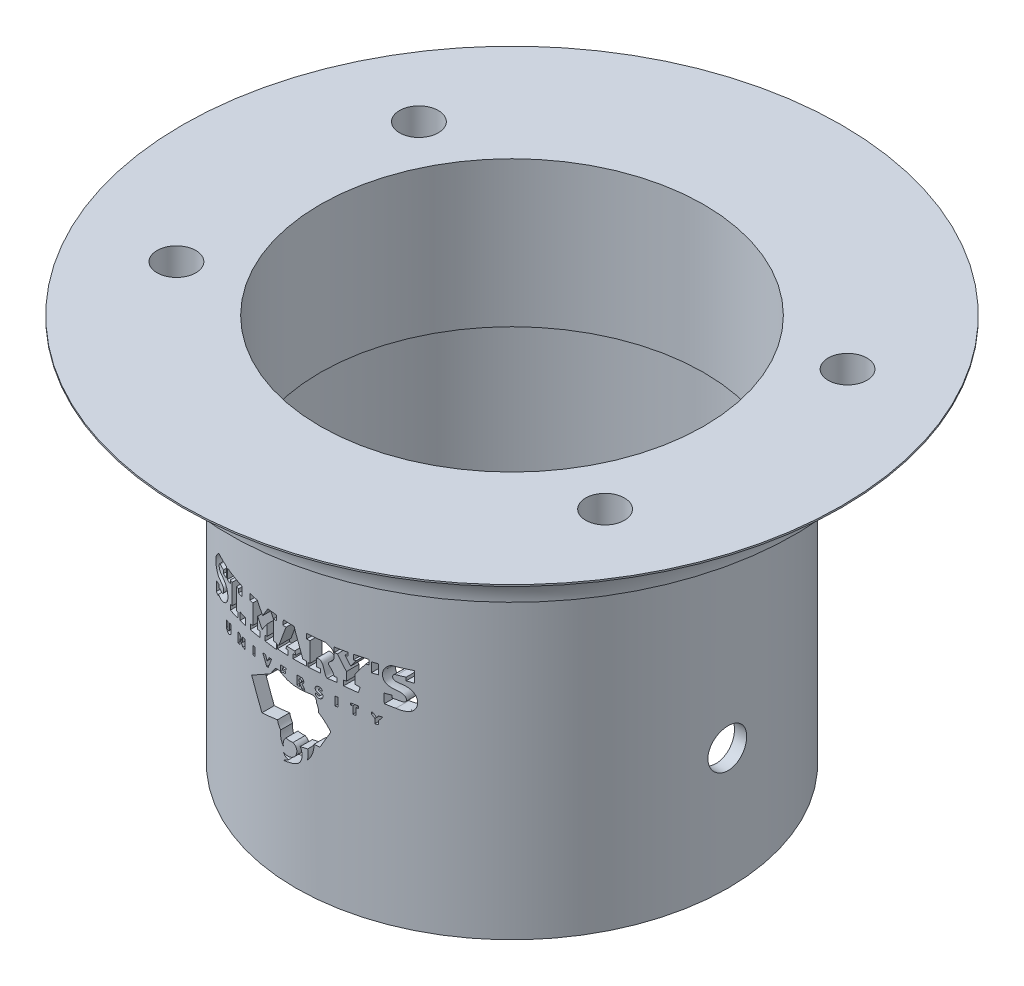
from build123d import *

# Parameters (mm, degrees)
SKETCH1_R               = 34
BOSS_EXTRUDE1_DEPTH     = 10
SKETCH2_R               = 19.7871926
SKETCH2_R_2             = 2
CUT_EXTRUDE1_DEPTH      = 10
SKETCH3_R               = 4.837531333
SKETCH4_W               = 4.837531333
SKETCH4_H               = 4.837531333
CUT_EXTRUDE3_DEPTH      = 38
CUT_EXTRUDE3_DEPTH_BACK = 38
SKETCH5_W               = 72.361656805
SKETCH5_H               = 8.896778435
BOSS_EXTRUDE2_START     = 35
SKETCH6_R               = 22.2871926
SKETCH6_R_2             = 19.7871926
BOSS_EXTRUDE2_DEPTH     = 35
SKETCH7_R               = 21.0371926
SKETCH7_R_2             = 19.7871926
CUT_EXTRUDE4_DEPTH      = 25
CUT_EXTRUDE5_DEPTH      = 59
CUT_EXTRUDE5_DEPTH_BACK = 45
SKETCH9_R               = 2
SKETCH12_W              = 0.263768511
SKETCH12_H              = 0.832043755
SKETCH12_W_2            = 0.284163404
SKETCH12_H_2            = 0.878419158
SKETCH12_W_3            = 0.554118638
SKETCH12_H_3            = 0.980849503
CUT_EXTRUDE14_DEPTH     = 10


with BuildPart() as part:
    # Sketch1 → Boss-Extrude1 (new body)
    with BuildSketch(Plane(origin=(0, 0, 0), x_dir=(1, 0, 0), z_dir=(0, 1, 0))):
        Circle(SKETCH1_R)
    extrude(amount=BOSS_EXTRUDE1_DEPTH)

    # Sketch2 → Cut-Extrude1 (cut)
    with BuildSketch(Plane.XZ):
        Circle(SKETCH2_R)
        with Locations((-22.1, 12.5)):
            Circle(SKETCH2_R_2)
        with Locations((22.1, 12.5)):
            Circle(SKETCH2_R_2)
        with Locations((22.1, -12.5)):
            Circle(SKETCH2_R_2)
        with Locations((-22.1, -12.5)):
            Circle(SKETCH2_R_2)
    extrude(amount=-CUT_EXTRUDE1_DEPTH, mode=Mode.SUBTRACT)

    # Sketch3 → Cut-Revolve1 (revolve, cut)
    with BuildSketch(Plane(origin=(0, 0, 0), x_dir=(0, 0, -1), z_dir=(1, 0, 0))):
        with Locations((-34, 5)):
            Circle(SKETCH3_R)
    revolve(axis=Axis((0, 0, 0), (0, 1, 0)), mode=Mode.SUBTRACT)

    # Sketch4 → Cut-Revolve2 (revolve, cut)
    with BuildSketch(Plane(origin=(0, 0, 0), x_dir=(0, 0, -1), z_dir=(1, 0, 0))):
        with Locations((-31.581234333, 2.581234333)):
            Rectangle(SKETCH4_W, SKETCH4_H)
    revolve(axis=Axis((0, 0, 0), (0, 1, 0)), mode=Mode.SUBTRACT)

    # Sketch5 → Cut-Extrude3 (cut, two sides: drawn at the far end of the back side and taken through both)
    with BuildSketch(Plane(origin=(0, 0, 0), x_dir=(0, 0, -1), z_dir=(1, 0, 0)).offset(-CUT_EXTRUDE3_DEPTH_BACK)):
        with Locations((-0.901301775, 0.551610782)):
            Rectangle(SKETCH5_W, SKETCH5_H)
    extrude(amount=CUT_EXTRUDE3_DEPTH + CUT_EXTRUDE3_DEPTH_BACK, mode=Mode.SUBTRACT)

    # Sketch6 → Boss-Extrude2 (add)
    with BuildSketch(Plane.XZ.offset(-5).offset(BOSS_EXTRUDE2_START)):
        Circle(SKETCH6_R)
        Circle(SKETCH6_R_2, mode=Mode.SUBTRACT)
    extrude(amount=-BOSS_EXTRUDE2_DEPTH)

    # Sketch7 → Cut-Extrude4 (cut)
    with BuildSketch(Plane.XZ.offset(30)):
        Circle(SKETCH7_R)
        Circle(SKETCH7_R_2, mode=Mode.SUBTRACT)
    extrude(amount=-CUT_EXTRUDE4_DEPTH, mode=Mode.SUBTRACT)

    # Sketch9 → Cut-Extrude5 (cut, two sides: drawn at the far end of the back side and taken through both)
    with BuildSketch(Plane(origin=(0, 0, 0), x_dir=(0, 0, -1), z_dir=(1, 0, 0)).offset(-CUT_EXTRUDE5_DEPTH_BACK)):
        with Locations((0, -17.5)):
            Circle(SKETCH9_R)
    extrude(amount=CUT_EXTRUDE5_DEPTH + CUT_EXTRUDE5_DEPTH_BACK, mode=Mode.SUBTRACT)

    # Sketch12 → Cut-Extrude14 (cut)
    # profile 1 of 20: a face of its own
    with BuildSketch(Plane.XY.offset(22.2871926)):
        with BuildLine():
            Line((1.794082378, -16.29437946), (2.360143314, -16.285802779))
            Line((2.360143314, -16.285802779), (3.346461612, -14.527583205))
            add(Edge.make_bspline(
                [(3.346461612, -14.527583205), (2.910968922, -13.79752965), (2.240069782, -13.275387802)],
                knots=[0, 0, 0, 1, 1, 1], degree=2))
            add(Edge.make_bspline(
                [(2.240069782, -13.275387802), (2.236403294, -12.836372194), (2.029238254, -12.443084191)],
                knots=[0, 0, 0, 1, 1, 1], degree=2))
            add(Edge.make_bspline(
                [(-2.86057767, -12.380282127), (-2.590343123, -12.244040488), (-2.423232876, -11.454590672), (-1.721635975, -11.49424037), (-1.307191367, -11.712675323), (-0.635536447, -11.971879241), (0.252506882, -12.046566507), (1.230384194, -12.007416665), (2.036999074, -11.856073044), (2.029238254, -12.443084191)],
                knots=[0, 0, 0, 0, 0.207613915, 0.255303168, 0.349193661, 0.455828664, 0.635269324, 0.809737725, 1, 1, 1, 1], degree=3))
            add(Edge.make_bspline(
                [(-5.165198112, -13.850849457), (-4.009285593, -13.121211523), (-2.86057767, -12.380282127)],
                knots=[0, 0, 0, 1, 1, 1], degree=2))
            Line((-5.165198112, -13.850849457), (-3.826323379, -16.418855093))
            Line((-3.826323379, -16.418855093), (-1.982627025, -16.001828537))
            add(Edge.make_bspline(
                [(-1.982627025, -16.001828537), (-1.86221105, -16.447255631), (-1.6338188, -16.722478034)],
                knots=[0, 0, 0, 0.333862906, 0.333862906, 0.333862906], degree=2))
            add(Edge.make_bspline(
                [(-1.6338188, -16.722478034), (-1.732940807, -17.447919415), (-1.324164041, -18.01829231)],
                knots=[0, 0, 0, 1, 1, 1], degree=2))
            add(Edge.make_bspline(
                [(-1.040452534, -17.111285315), (-1.426685404, -17.499697564), (-1.324164041, -18.01829231)],
                knots=[0, 0, 0, 1, 1, 1], degree=2))
            add(Edge.make_bspline(
                [(-1.040452534, -17.111285315), (-0.715545345, -17.204516794), (-0.292572034, -17.143164375)],
                knots=[0.681826442, 0.681826442, 0.681826442, 1, 1, 1], degree=2))
            add(Edge.make_bspline(
                [(-0.292572034, -17.143164375), (0.228825017, -17.40072547), (0.153468574, -18.198689771), (-0.625373848, -18.672989269), (-1.08531239, -18.664297103), (-1.324164041, -18.51887831)],
                knots=[0, 0, 0, 0, 0.500944797, 0.699688043, 1, 1, 1, 1], degree=3))
            add(Edge.make_bspline(
                [(-1.324164041, -18.51887831), (-1.149551105, -18.892050378), (-0.757850148, -18.920991778)],
                knots=[0, 0, 0, 1, 1, 1], degree=2))
            add(Edge.make_bspline(
                [(-0.757850148, -18.920991778), (-1.0407023, -19.095736242), (-1.324164041, -19.269490118)],
                knots=[0, 0, 0, 1, 1, 1], degree=2))
            add(Edge.make_bspline(
                [(-1.324164041, -19.269490118), (-0.794094463, -19.132752919), (0.661104072, -19.002249948), (0.71462124, -17.549783086), (0.438966805, -17.143164375)],
                knots=[0, 0, 0, 0, 0.551984151, 1, 1, 1, 1], degree=3))
            Line((0.438966805, -17.143164375), (1.185138038, -16.989523012))
            add(Edge.make_bspline(
                [(1.185138038, -16.989523012), (1.299662609, -17.505225873), (1.159407996, -18.01829231)],
                knots=[0, 0, 0, 1, 1, 1], degree=2))
            add(Edge.make_bspline(
                [(1.794082378, -16.29437946), (1.816220329, -17.282925625), (1.159407996, -18.01829231)],
                knots=[0, 0, 0, 1, 1, 1], degree=2))
        make_face()
    # profile 2 of 20: a face of its own
    with BuildSketch(Plane.XY.offset(22.2871926)):
        with BuildLine():
            add(Edge.make_bspline(
                [(-9.093186088, -12.257025895), (-8.683472436, -12.774735356), (-8.24847579, -12.238254555)],
                knots=[0, 0, 0, 1, 1, 1], degree=2))
            Line((-8.24847579, -12.238254555), (-8.24847579, -11.412315597))
            Line((-8.24847579, -11.412315597), (-8.539431559, -11.412315597))
            Line((-8.539431559, -11.412315597), (-8.539431559, -12.078698166))
            add(Edge.make_bspline(
                [(-8.849158668, -12.163169196), (-8.800570518, -12.209184804), (-8.681442608, -12.322005383), (-8.59224723, -12.169187139), (-8.539431559, -12.078698166)],
                knots=[0, 0, 0, 0, 0.407865383, 1, 1, 1, 1], degree=3))
            Line((-8.849158668, -12.163169196), (-8.849158668, -11.543714977))
            Line((-8.849158668, -11.543714977), (-9.093186088, -11.543714977))
            Line((-9.093186088, -11.543714977), (-9.093186088, -12.257025895))
        make_face()
    # profile 3 of 20: a face of its own
    with BuildSketch(Plane.XY.offset(22.2871926)):
        Polygon((-7.122195392, -11.252759208), (-7.122195392, -12.238254555), (-6.810121866, -12.238254555), (-6.810121866, -11.639918094), (-6.422962979, -12.163169196), (-6.099157365, -12.163169196), (-6.099157365, -11.252759208), (-6.422962979, -11.252759208), (-6.422962979, -11.745506882), (-6.915710653, -11.252759208), align=None)
    # profile 4 of 20: a face of its own
    with BuildSketch(Plane.XY.offset(22.2871926)):
        with Locations((-4.863707587, -11.523064448)):
            Rectangle(SKETCH12_W, SKETCH12_H)
    # profile 5 of 20: a face of its own
    with BuildSketch(Plane.XY.offset(22.2871926)):
        Polygon((-3.391122103, -10.978710478), (-3.731978347, -10.978710478), (-3.239630439, -11.939086325), (-3.061627734, -11.939086325), (-2.663962115, -10.978710478), (-2.936647111, -10.978710478), (-3.186608356, -11.412315597), align=None)
    # profile 6 of 20: a face of its own
    with BuildSketch(Plane.XY.offset(22.2871926)):
        with Locations((3.859937493, -11.586863234)):
            Rectangle(SKETCH12_W_2, SKETCH12_H_2)
    # profile 7 of 20: a face of its own
    with BuildSketch(Plane.XY.offset(22.2871926)):
        with BuildLine():
            Line((0.097322493, -10.902964646), (0.097322493, -11.806953267))
            Line((0.097322493, -11.806953267), (0.385325199, -11.806953267))
            Line((0.385325199, -11.806953267), (0.385325199, -11.543714977))
            Line((0.385325199, -11.543714977), (0.63098158, -11.901543645))
            Line((0.63098158, -11.901543645), (0.934866199, -11.901543645))
            Line((0.934866199, -11.901543645), (0.63098158, -11.458898402))
            add(Edge.make_bspline(
                [(0.63098158, -10.902964646), (0.861270728, -11.115489144), (0.861270728, -11.300800396), (0.63098158, -11.458898402)],
                knots=[0, 0, 0, 0, 1, 1, 1, 1], degree=3))
            Line((0.63098158, -10.902964646), (0.097322493, -10.902964646))
        make_face()
        with BuildLine():
            Line((0.338087158, -11.357864761), (0.338087158, -11.147653655))
            ThreePointArc((0.338087158, -11.147653655), (0.584650985, -11.252759208), (0.338087158, -11.357864761))
        make_face(mode=Mode.SUBTRACT)
    # profile 8 of 20: a face of its own
    with BuildSketch(Plane.XY.offset(22.2871926)):
        Polygon((5.073414561, -11.412315597), (5.245234088, -11.412315597), (5.245234088, -12.163169196), (5.522293408, -12.163169196), (5.522293408, -11.479398585), (5.70699962, -11.479398585), (5.70699962, -11.252759208), (5.073414561, -11.209103026), align=None)
    # profile 9 of 20: a face of its own
    with BuildSketch(Plane.XY.offset(22.2871926)):
        Polygon((6.73709196, -11.412315597), (6.73709196, -11.586863234), (7.014151279, -11.901543645), (7.014151279, -12.380282127), (7.291210598, -12.380282127), (7.291210598, -12.026072813), (7.625102598, -11.586863234), (7.291210598, -11.586863234), (7.152680939, -11.769088485), (6.838561439, -11.412315597), align=None)
    # profile 10 of 20: a face of its own
    with BuildSketch(Plane.XY.offset(22.2871926)):
        with BuildLine():
            Line((-9.981393277, -9.787666303), (-10.648814746, -9.787666303))
            Line((-10.648814746, -9.787666303), (-10.648814746, -9.530396884))
            Line((-10.648814746, -9.530396884), (-11.263402804, -9.659031594))
            Line((-11.263402804, -9.659031594), (-11.263402804, -10.669086315))
            Line((-11.263402804, -10.669086315), (-10.731240201, -10.669086315))
            Line((-10.731240201, -10.669086315), (-10.731240201, -10.502303579))
            add(Edge.make_bspline(
                [(-10.315104012, -7.515119765), (-10.604781201, -7.522556486), (-10.650640674, -8.161789214), (-9.821119581, -8.253402325), (-8.994626539, -8.479107332), (-8.543742945, -10.105897824), (-10.098060987, -10.697475699), (-10.731240201, -10.502303579)],
                knots=[0, 0, 0, 0, 0.121852497, 0.225225517, 0.406479529, 0.579433197, 1, 1, 1, 1], degree=3))
            Line((-10.315104012, -7.515119765), (-9.662615305, -7.515119765))
            Line((-9.662615305, -7.515119765), (-9.662615305, -7.843852912))
            Line((-9.662615305, -7.843852912), (-9.093186088, -7.843852912))
            Line((-9.093186088, -7.843852912), (-9.093186088, -6.786189743))
            Line((-9.093186088, -6.786189743), (-10.648814746, -6.786189743))
            add(Edge.make_bspline(
                [(-9.981393277, -9.787666303), (-9.708598761, -9.785781377), (-9.449716252, -9.123977304), (-10.205386004, -8.93464128), (-10.908582806, -8.938626133), (-11.747661922, -7.884686569), (-10.97937642, -7.059466757), (-10.648814746, -6.786189743)],
                knots=[0, 0, 0, 0, 0.163024053, 0.300623513, 0.421053766, 0.661028375, 1, 1, 1, 1], degree=3))
        make_face()
    # profile 11 of 20: a face of its own
    with BuildSketch(Plane.XY.offset(22.2871926)):
        Polygon((-8.931375073, -6.786189743), (-8.931375073, -7.843852912), (-8.412665731, -7.843852912), (-8.412665731, -7.515119765), (-8.111709889, -7.515119765), (-8.111709889, -9.622152899), (-8.395287567, -9.659031594), (-8.395287567, -10.196972518), (-7.122195392, -10.031409496), (-7.122195392, -9.530396884), (-7.372108646, -9.530396884), (-7.372108646, -7.375206002), (-7.063993067, -7.375206002), (-7.063993067, -7.740736097), (-6.533711213, -7.740736097), (-6.533711213, -6.786189743), align=None)
    # profile 12 of 20: a face of its own
    with BuildSketch(Plane.XY.offset(22.2871926)):
        Polygon((-6.810121866, -9.286115782), (-6.810121866, -10.031409496), (-6.032358963, -9.978715841), (-6.032358963, -9.286115782), align=None)
    # profile 13 of 20: a face of its own
    with BuildSketch(Plane.XY.offset(22.2871926)):
        Polygon((-5.345047246, -9.410115691), (-5.345047246, -9.909345257), (-4.058360686, -9.851839713), (-4.058360686, -9.286115782), (-4.371047084, -9.286115782), (-4.371047084, -8.119485182), (-3.799585735, -8.960503771), (-3.186608356, -8.119485182), (-3.186608356, -9.222872819), (-3.432987888, -9.286115782), (-3.432987888, -9.787666303), (-2.089846399, -9.787666303), (-2.089846399, -9.207823859), (-2.435535341, -9.207823859), (-2.435535341, -7.232697), (-2.122473295, -7.232697), (-2.122473295, -6.710767683), (-3.097013191, -6.710767683), (-3.731978347, -7.685246168), (-4.434457065, -6.710767683), (-5.392686669, -6.710767683), (-5.392686669, -7.314248455), (-4.995591842, -7.314248455), (-4.995591842, -9.320414266), align=None)
    # profile 14 of 20: a face of its own
    with BuildSketch(Plane.XY.offset(22.2871926)):
        Polygon((-1.982627025, -9.659031594), (-0.840732068, -9.659031594), (-0.840732068, -9.152144334), (-1.068221949, -9.152144334), (-0.962273501, -8.876703942), (-0.119786228, -8.876703942), (0, -9.207823859), (-0.292572034, -9.207823859), (-0.292572034, -9.659031594), (1.070568768, -9.659031594), (1.070568768, -9.207823859), (0.711800947, -9.207823859), (-0.191536255, -6.710767683), (-1.324164041, -6.710767683), (-1.39900672, -7.232697), (-1.04045227, -7.232697), (-1.819916496, -9.25911585), (-1.982627025, -9.286115782), align=None)
    # profile 15 of 20: a face of its own
    with BuildSketch(Plane.XY.offset(22.2871926)):
        with BuildLine():
            Line((1.236598123, -9.659031594), (2.42196736, -9.659031594))
            Line((2.42196736, -9.659031594), (2.42196736, -9.25911585))
            Line((2.42196736, -9.25911585), (2.053831343, -9.25911585))
            Line((2.053831343, -9.25911585), (2.053831343, -8.480168908))
            add(Edge.make_bspline(
                [(3.04058768, -9.851839713), (2.645498011, -9.685604409), (2.835876236, -8.273808899), (2.053831343, -8.480168908)],
                knots=[0, 0, 0, 0, 1, 1, 1, 1], degree=3))
            Line((3.04058768, -9.851839713), (3.877624904, -9.851839713))
            Line((3.877624904, -9.851839713), (3.877624904, -9.410115691))
            Line((3.877624904, -9.410115691), (3.653862478, -9.410115691))
            add(Edge.make_bspline(
                [(3.653862478, -9.410115691), (3.583212784, -9.204936452), (3.471775126, -8.881301732), (2.963533541, -8.441791575), (3.520124523, -8.145181702), (3.713974434, -7.667937742), (3.542576868, -7.032810478), (3.146224677, -6.82627416), (2.924562718, -6.710767683)],
                knots=[0, 0, 0, 0, 0.20436504, 0.322350463, 0.469542898, 0.613052072, 0.783597422, 1, 1, 1, 1], degree=3))
            Line((2.924562718, -6.710767683), (1.070568768, -6.710767683))
            Line((1.070568768, -6.710767683), (1.070568768, -7.232697))
            Line((1.070568768, -7.232697), (1.39966322, -7.232697))
            Line((1.39966322, -7.232697), (1.39966322, -9.25911585))
            Line((1.39966322, -9.25911585), (1.236598123, -9.25911585))
            Line((1.236598123, -9.25911585), (1.236598123, -9.659031594))
        make_face()
    # profile 16 of 20: a face of its own
    with BuildSketch(Plane.XY.offset(22.2871926)):
        Polygon((4.836228125, -6.786189743), (3.653862478, -6.786189743), (3.653862478, -7.284609082), (3.934264817, -7.284609082), (4.711921617, -8.552567475), (4.711921617, -9.410115691), (4.470305331, -9.410115691), (4.470305331, -9.932712739), (5.70699962, -10.059400992), (5.851231886, -9.530396884), (5.410073696, -9.410115691), (5.410073696, -8.552567475), (6.292390075, -7.284609082), (6.552841806, -7.284609082), (6.552841806, -6.786189743), (5.297853984, -6.786189743), (5.297853984, -7.284609082), (5.522293408, -7.284609082), (5.073414561, -7.929683473), (4.587615109, -7.137594351), (4.836228125, -7.137594351), align=None)
    # profile 17 of 20: a face of its own
    with BuildSketch(Plane.XY.offset(22.2871926)):
        with Locations((7.014151279, -7.428163527)):
            Rectangle(SKETCH12_W_3, SKETCH12_H_3)
    # profile 18 of 20: a face of its own
    with BuildSketch(Plane.XY.offset(22.2871926)):
        with BuildLine():
            Line((8.293608019, -9.410115691), (7.719887392, -9.410115691))
            Line((7.719887392, -9.410115691), (7.732636739, -10.360305162))
            Line((7.732636739, -10.360305162), (8.585622976, -10.502303579))
            add(Edge.make_bspline(
                [(8.653066174, -7.515119765), (8.353747449, -7.436107022), (8.258706752, -8.114890388), (9.155934218, -8.211540011), (9.940933494, -8.666223728), (10.248098629, -9.63249027), (9.795933147, -10.694401825), (8.925787098, -10.596383167), (8.585622976, -10.502303579)],
                knots=[0, 0, 0, 0, 0.112519879, 0.251894864, 0.422201346, 0.623587799, 0.768430808, 1, 1, 1, 1], degree=3))
            Line((8.653066174, -7.515119765), (9.328372089, -7.515119765))
            Line((9.328372089, -7.515119765), (9.328372089, -7.843852912))
            Line((9.328372089, -7.843852912), (9.920306904, -7.918588278))
            Line((9.920306904, -7.918588278), (9.920306904, -6.786189743))
            Line((9.920306904, -6.786189743), (8.477986862, -6.786189743))
            add(Edge.make_bspline(
                [(8.477986862, -6.786189743), (8.234964427, -6.738988471), (7.854173938, -6.99085599), (7.582615498, -7.5139203), (7.582384029, -8.071517736), (7.866117747, -8.590878111), (8.444508839, -8.841741575), (9.003074622, -8.962283823), (9.369586552, -9.335378802), (9.339402655, -9.823874347), (9.040459587, -9.796957959), (8.873666217, -9.757256639)],
                knots=[0.144200399, 0.144200399, 0.144200399, 0.144200399, 0.277346197, 0.370102525, 0.46871268, 0.579012334, 0.679582974, 0.811820653, 0.895290921, 0.956706672, 1.025789329, 1.025789329, 1.025789329, 1.025789329], degree=3))
            Line((8.873666217, -9.757256639), (8.293608019, -9.659031594))
            add(Edge.make_bspline(
                [(8.293608019, -9.659031594), (8.292314439, -9.650220534), (8.293608019, -9.643410107)],
                knots=[0, 0, 0, 0.006190799, 0.006190799, 0.006190799], degree=2))
            Line((8.293608019, -9.643410107), (8.293608019, -9.410115691))
        make_face()
    # profile 19 of 20: a face of its own
    with BuildSketch(Plane.XY.offset(22.2871926)):
        Polygon((-1.6338188, -10.902964646), (-1.6338188, -11.501306689), (-1.39900672, -11.501306689), (-1.39900672, -11.423665989), (-1.068221949, -11.423665989), (-1.068221949, -11.250517836), (-1.4267764, -11.250517836), (-1.4267764, -11.087152791), (-1.063519655, -11.087152791), (-1.063519655, -10.902964646), align=None)
    # profile 20 of 20: a face of its own
    with BuildSketch(Plane.XY.offset(22.2871926)):
        with BuildLine():
            add(Edge.make_bspline(
                [(2.029278879, -11.62144113), (1.973547308, -11.635273569), (1.876128947, -11.724705871), (2.079359779, -11.959462057), (2.336849734, -12.003718209), (2.562915688, -11.887638944), (2.66741636, -11.67189817), (2.612978648, -11.421821859), (2.405664026, -11.370178646), (2.137512443, -11.272468326), (2.305442667, -11.102833152), (2.433350511, -11.261915077), (2.629270894, -11.22747982), (2.563546313, -11.10704257)],
                knots=[0.007346389, 0.007346389, 0.007346389, 0.007346389, 0.060831012, 0.192423244, 0.280822126, 0.405186076, 0.487492921, 0.584598932, 0.684829509, 0.779546256, 0.83080703, 0.89388498, 1, 1, 1, 1], degree=3))
            add(Edge.make_bspline(
                [(2.563546313, -11.10704257), (2.460876105, -10.886065864), (1.913751203, -10.877868191), (1.893530728, -11.421317444), (2.220857023, -11.520438342), (2.477007569, -11.727817394), (2.206484031, -11.769088485)],
                knots=[0, 0, 0, 0, 0.415187549, 0.575786917, 0.771495741, 1, 1, 1, 1], degree=3))
            add(Edge.make_bspline(
                [(2.206484031, -11.769088485), (2.123399915, -11.751776118), (2.109197281, -11.637360176), (2.029278879, -11.62144113)],
                knots=[0, 0, 0, 0, 1, 1, 1, 1], degree=3))
        make_face()
    extrude(amount=-CUT_EXTRUDE14_DEPTH, mode=Mode.SUBTRACT)


with BuildPart() as cut_extrude14_piece_1:
    # of the separate pieces the step leaves, piece 1, a body of its own (cut_extrude14_pieces)
    add(part.part.solids().sort_by_distance((-20.1, 5, 12.5))[0])


with BuildPart() as cut_extrude14_piece_2:
    # of the separate pieces the step leaves, piece 2, a body of its own (cut_extrude14_pieces)
    add(part.part.solids().sort_by_distance((0.338087158, -11.147653655, 22.284628134))[0])


solid = Compound([cut_extrude14_piece_1.part, cut_extrude14_piece_2.part])
